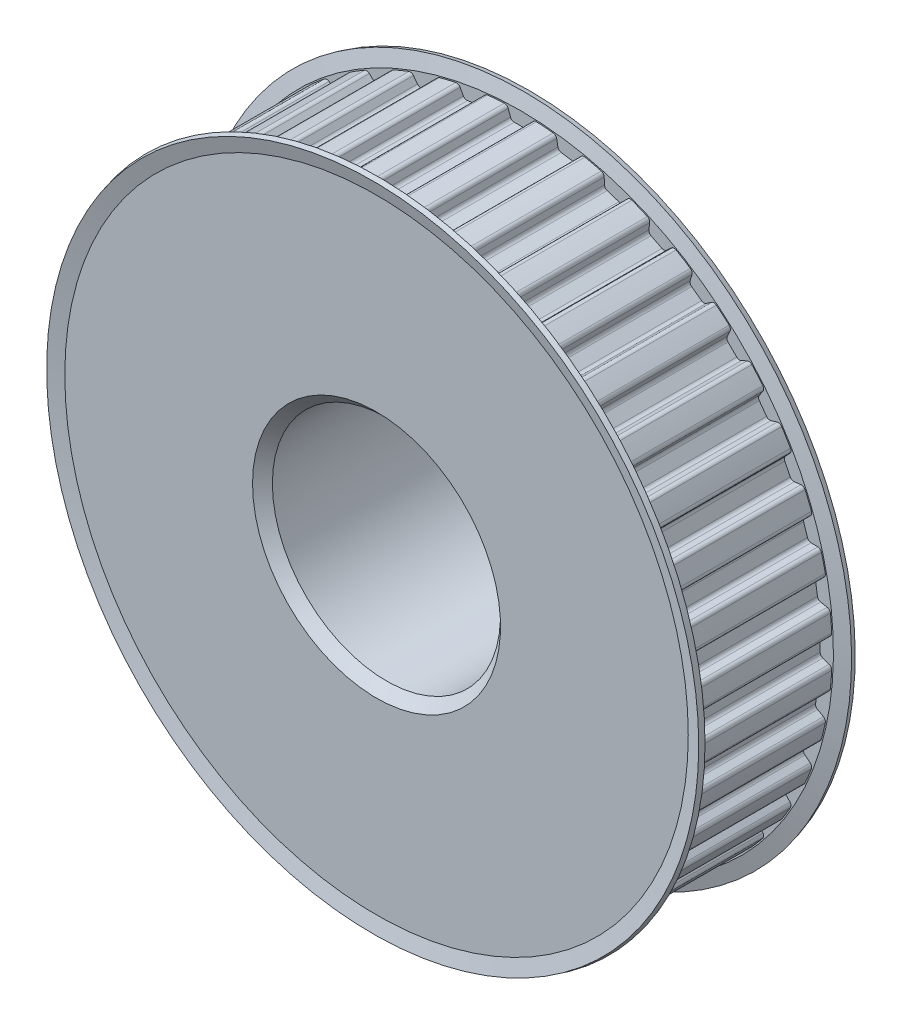
from build123d import *

# Parameters (mm, degrees)
SKETCH5_W           = 15
SKETCH5_H           = 31.425
SKETCH16_W          = 6
SKETCH16_H          = 20
SKETCH17_W          = 21
SKETCH17_H          = 4
CUT_TOOTH_REACH     = 51.153
PATTERN_TOOTH_COUNT = 40
CUT_EXTRUDE_1_DEPTH = 52.176166328
SKETCH_2_R          = 11.5
CUT_EXTRUDE_2_DEPTH = 30
CHAMFER_1_SIZE      = 1


with BuildPart() as part:
    # Sketch5 → body (revolve)
    with BuildSketch(Plane(origin=(0, 0, 0), x_dir=(0, 0, -1), z_dir=(1, 0, 0))):
        with Locations((7.5, 15.7125)):
            Rectangle(SKETCH5_W, SKETCH5_H)
    revolve(axis=Axis((0, 0, 0), (0, 0, -1)))

    # Sketch16 → body-hub (revolve)
    with BuildSketch(Plane(origin=(0, 0, 0), x_dir=(0, 0, -1), z_dir=(1, 0, 0))):
        with Locations((18, 10)):
            Rectangle(SKETCH16_W, SKETCH16_H)
    revolve(axis=Axis((0, 0, -21), (0, 0, 1)))

    # Sketch17 → body-bore (revolve, cut)
    with BuildSketch(Plane(origin=(0, 0, 0), x_dir=(0, 0, -1), z_dir=(1, 0, 0))):
        with Locations((10.5, 2)):
            Rectangle(SKETCH17_W, SKETCH17_H)
    revolve(axis=Axis((0, 0, -21), (0, 0, 1)), mode=Mode.SUBTRACT)

    # Sketch23 → cut-tooth (cut, up to next)
    with BuildSketch(Plane.XY, mode=Mode.PRIVATE) as cut_tooth_sk1:
        with BuildLine():
            Line((1.622438917, 32.583089666), (-1.622438917, 32.583089666))
            Line((-1.622438917, 32.583089666), (-1.622438917, 31.383089666))
            ThreePointArc((-1.622438917, 31.383089666), (-1.380894491, 31.317099285), (-1.225910299, 31.120431188))
            Line((-1.225910299, 31.120431188), (-0.995794033, 30.488191943))
            ThreePointArc((-0.995794033, 30.488191943), (-0.849347559, 30.297339182), (-0.619916985, 30.225))
            Line((-0.619916985, 30.225), (0.619916985, 30.225))
            ThreePointArc((0.619916985, 30.225), (0.849347559, 30.297339182), (0.995794033, 30.488191943))
            Line((0.995794033, 30.488191943), (1.225910299, 31.120431188))
            ThreePointArc((1.225910299, 31.120431188), (1.380894491, 31.317099285), (1.622438917, 31.383089666))
            Line((1.622438917, 31.383089666), (1.622438917, 32.583089666))
        make_face()
    cut_tooth_tool1 = extrude(cut_tooth_sk1.sketch, amount=-CUT_TOOTH_REACH, mode=Mode.PRIVATE) & part.part
    cut_tooth = cut_tooth_tool1.solids().sort_by_distance((0, 31.533212, 0))[0]
    add(cut_tooth, mode=Mode.SUBTRACT)

    # pattern-tooth: cut-tooth ×40 about axis
    pattern_tooth_axis = Axis((0, 0, 0), (0, 0, -1))
    for i in range(1, PATTERN_TOOTH_COUNT):
        add(cut_tooth.rotate(pattern_tooth_axis, i * 360 / PATTERN_TOOTH_COUNT), mode=Mode.SUBTRACT)

    # Sketch25 → body-flange-front (revolve)
    with BuildSketch(Plane(origin=(0, 0, 0), x_dir=(0, 0, -1), z_dir=(1, 0, 0))):
        Polygon((0.5, 28.71375), (0, 28.71375), (0, 31.425), (-0.386121593, 32.866025404), (0.113878407, 33), (0.5, 31.558974596), align=None)
    revolve(axis=Axis((0, 0, 0), (0, 0, -1)))

    # Sketch26 → body-flange-back (revolve)
    with BuildSketch(Plane(origin=(0, 0, 0), x_dir=(0, 0, -1), z_dir=(1, 0, 0))):
        Polygon((14.5, 28.71375), (15, 28.71375), (15, 31.425), (15.386121593, 32.866025404), (14.886121593, 33), (14.5, 31.558974596), align=None)
    revolve(axis=Axis((0, 0, -15), (0, 0, 1)))

    # Эскиз1 → Вырез-Вытянуть1 (cut, through all)
    with BuildSketch(Plane.XY):
        with BuildLine():
            Line((6.5, 3.741657387), (6.5, -3.741657387))
            ThreePointArc((6.5, -3.741657387), (-7.5, 0), (6.5, 3.741657387))
        make_face()
    extrude(amount=-CUT_EXTRUDE_1_DEPTH, mode=Mode.SUBTRACT)

    # Эскиз2 → Вырез-Вытянуть2 (cut)
    with BuildSketch(Plane.XY):
        Circle(SKETCH_2_R)
    extrude(amount=-CUT_EXTRUDE_2_DEPTH, mode=Mode.SUBTRACT)

    # Фаска1
    chamfer_1_edges = [part.edges().sort_by_distance(p)[0] for p in [
        (-11.5, 0, 0),
    ]]
    chamfer(chamfer_1_edges, length=CHAMFER_1_SIZE)


solid = part.part
